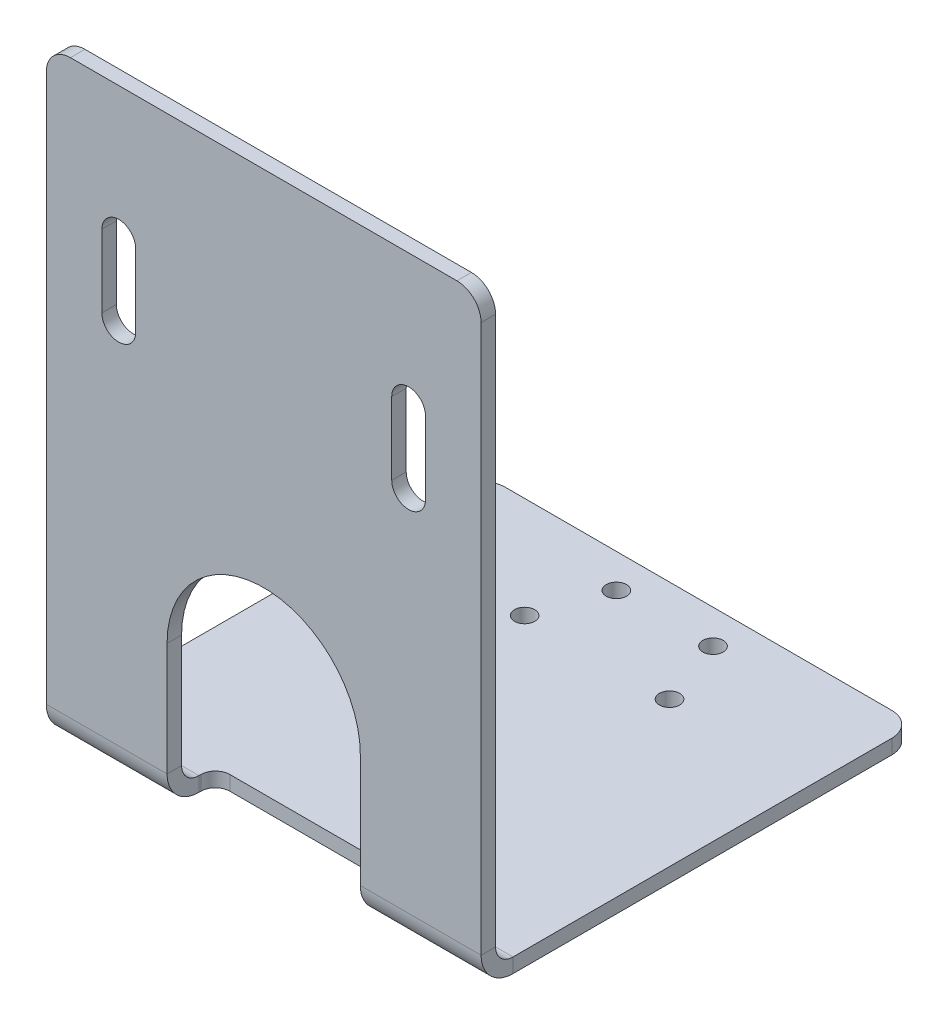
from build123d import *

# Parameters (mm, degrees)
BOSS_EXTRUDE1_DEPTH        = 45
FLATTEN_BENDS1_START       = -45
FLATTEN_BENDS1_OUTLINE_W   = 122
FLATTEN_BENDS1_OUTLINE_H   = 3
FLATTEN_BENDS1_DEPTH       = 90
FLATTEN_BENDS1_2_OUTLINE_W = 3
FLATTEN_BENDS1_2_OUTLINE_H = 119.533030317
FLATTEN_BENDS1_2_DEPTH     = 90
PROCESS_BENDS1_START       = -45
PROCESS_BENDS1_DEPTH       = 90
PROCESS_BENDS1_2_DEPTH     = 90
SKETCH8_W                  = 40
SKETCH8_H                  = 6.6
SKETCH8_H_2                = 23.4
CUT_EXTRUDE1_DEPTH         = 10
FILLET1_R                  = 3
FILLET2_R                  = 5
CUT_EXTRUDE2_DEPTH         = 80
SKETCH10_R                 = 2.1
CUT_EXTRUDE3_DEPTH         = 80


# Read off the part's stored shape, not the designer's step: Flatten-Bends1, Process-Bends1
with BuildPart() as part:
    # Sketch1 → Boss-Extrude1 (new, symmetric)
    with BuildSketch(Plane(origin=(0, 0, 0), x_dir=(0, 0, -1), z_dir=(1, 0, 0))):
        Polygon((0, 125), (0, 0), (90, 0), (90, 3), (3, 3), (3, 125), align=None)
    extrude(amount=BOSS_EXTRUDE1_DEPTH, both=True)

    # Flatten-Bends1 outline → Flatten-Bends1 (cut)
    with BuildSketch(Plane.YZ.offset(FLATTEN_BENDS1_START)):
        with Locations((64, -1.5)):
            Rectangle(FLATTEN_BENDS1_OUTLINE_W, FLATTEN_BENDS1_OUTLINE_H)
    extrude(amount=FLATTEN_BENDS1_DEPTH, mode=Mode.SUBTRACT)

    # Flatten-Bends1 2 outline → Flatten-Bends1 2 (add)
    with BuildSketch(Plane.YZ.offset(FLATTEN_BENDS1_START)):
        with Locations((1.5, 59.766515159)):
            Rectangle(FLATTEN_BENDS1_2_OUTLINE_W, FLATTEN_BENDS1_2_OUTLINE_H)
    extrude(amount=FLATTEN_BENDS1_2_DEPTH)

    # Process-Bends1 outline → Process-Bends1 (cut)
    with BuildSketch(Plane.YZ.offset(PROCESS_BENDS1_START)):
        with BuildLine():
            ThreePointArc((0, -6.6), (0.798276118, -3.453573455), (3, -1.068273325))
            Line((3, -1.068273325), (3, 119.533030317))
            Line((3, 119.533030317), (0, 119.533030317))
            Line((0, 119.533030317), (0, -6.6))
        make_face()
    extrude(amount=PROCESS_BENDS1_DEPTH, mode=Mode.SUBTRACT)

    # Process-Bends1 2 outline → Process-Bends1 2 (add)
    with BuildSketch(Plane.YZ.offset(PROCESS_BENDS1_START)):
        with BuildLine():
            Line((6.6, -3), (125, -3))
            Line((125, -3), (125, 0))
            Line((125, 0), (6.6, 0))
            ThreePointArc((6.6, 0), (4.722421247, -0.272702154), (3, -1.068273325))
            Line((3, -1.068273325), (3, -6.6))
            ThreePointArc((3, -6.6), (4.054415588, -4.054415588), (6.6, -3))
        make_face()
    extrude(amount=PROCESS_BENDS1_2_DEPTH)

    # Sketch8 → Cut-Extrude1 (cut)
    with BuildSketch(Plane.XY):
        with BuildLine():
            ThreePointArc((-20, 30), (0, 50), (20, 30))
            Line((20, 30), (-20, 30))
        make_face()
        with Locations((0, 3.3)):
            Rectangle(SKETCH8_W, SKETCH8_H)
        with Locations((0, 18.3)):
            Rectangle(SKETCH8_W, SKETCH8_H_2)
    extrude(amount=-CUT_EXTRUDE1_DEPTH, mode=Mode.SUBTRACT)

    # Fillet1
    fillet1_edges = [part.edges().sort_by_distance(p)[0] for p in [
        (-20, 1.5, -10),
        (20, 1.5, -10),
    ]]
    fillet(fillet1_edges, radius=FILLET1_R)

    # Fillet2
    fillet2_edges = [part.edges().sort_by_distance(p)[0] for p in [
        (-45, 125, -1.5),
        (45, 125, -1.5),
        (45, 1.5, -90),
        (-45, 1.5, -90),
    ]]
    fillet(fillet2_edges, radius=FILLET2_R)

    # Sketch9 → Cut-Extrude2 (cut)
    with BuildSketch(Plane.XY):
        with BuildLine():
            Line((-26.5, 97.5), (-26.5, 82.5))
            ThreePointArc((-26.5, 82.5), (-30, 79), (-33.5, 82.5))
            Line((-33.5, 82.5), (-33.5, 97.5))
            ThreePointArc((-33.5, 97.5), (-30, 101), (-26.5, 97.5))
        make_face()
        with BuildLine():
            Line((26.5, 97.5), (26.5, 82.5))
            ThreePointArc((26.5, 82.5), (30, 79), (33.5, 82.5))
            Line((33.5, 82.5), (33.5, 97.5))
            ThreePointArc((33.5, 97.5), (30, 101), (26.5, 97.5))
        make_face()
    extrude(amount=-CUT_EXTRUDE2_DEPTH, mode=Mode.SUBTRACT)

    # Sketch10 → Cut-Extrude3 (cut)
    with BuildSketch(Plane(origin=(0, 3, 0), x_dir=(1, 0, 0), z_dir=(0, 1, 0))):
        with Locations(Location((-10, 83, 0), (0, 0, 270))):
            Circle(SKETCH10_R)
        with Locations(Location((10, 83, 0), (0, 0, 270))):
            Circle(SKETCH10_R)
        with Locations(Location((-15, 69, 0), (0, 0, 270))):
            Circle(SKETCH10_R)
        with Locations(Location((15, 69, 0), (0, 0, 270))):
            Circle(SKETCH10_R)
    extrude(amount=-CUT_EXTRUDE3_DEPTH, mode=Mode.SUBTRACT)


solid = part.part
